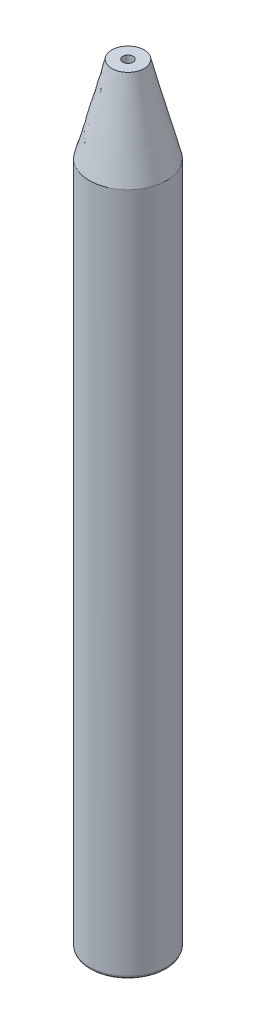
from build123d import *

# Parameters (mm, degrees)
SKETCH1_R           = 3.81
BOSS_EXTRUDE1_DEPTH = 67.7
SKETCH5_R           = 0.508
CUT_EXTRUDE2_DEPTH  = 77.390262478
SKETCH7_R           = 2.61
CUT_EXTRUDE3_DEPTH  = 6
CUT_EXTRUDE3_DRAFT  = -19.33
FILLET3_R           = 0.3


with BuildPart() as part:
    # Sketch1 → Boss-Extrude1 (new body)
    with BuildSketch(Plane(origin=(0, 0, 0), x_dir=(1, 0, 0), z_dir=(0, 1, 0))):
        with Locations(Location((0, 0, 0), (0, 0, 270))):
            Circle(SKETCH1_R)
    extrude(amount=BOSS_EXTRUDE1_DEPTH)

    # Loft1: read off the stored shape, not the designer's step
    # Loft1: loft between two sections, ruled curve by curve
    loft1_from = [
        Edge.make_bspline([(1.215970554, 76.2, 1.039911348), (-0.863852142, 76.2, 3.471852456), (-3.29579325, 76.2, 1.39202976), (-1.215970554, 76.2, -1.039911348), (0.863852142, 76.2, -3.471852456), (3.29579325, 76.2, -1.39202976), (1.215970554, 76.2, 1.039911348)], [0, 0, 0, 0, 0.5, 0.5, 0.5, 1, 1, 1, 1], 3, [1, 0.333333333, 0.333333333, 1, 0.333333333, 0.333333333, 1]),
    ]
    loft1_to = [
        Edge.make_bspline([(2.318114705, 67.7, 3.023647501), (-3.729180297, 67.7, 7.659876912), (-8.365409708, 67.7, 1.612581909), (-2.318114705, 67.7, -3.023647501), (3.729180297, 67.7, -7.659876912), (8.365409708, 67.7, -1.612581909), (2.318114705, 67.7, 3.023647501)], [0, 0, 0, 0, 0.5, 0.5, 0.5, 1, 1, 1, 1], 3, [1, 0.333333333, 0.333333333, 1, 0.333333333, 0.333333333, 1]),
    ]
    loft1 = Solid(Shell([*[Face.make_surface_from_curves(loft1_from[k], loft1_to[k]) for k in range(1)], Face(Wire(loft1_from)), Face(Wire(loft1_to))]))
    add(loft1)

    # Sketch5 → Cut-Extrude2 (cut, through all)
    with BuildSketch(Plane(origin=(0, 76.2, 0), x_dir=(1, 0, 0), z_dir=(0, 1, 0))):
        with Locations(Location((0, 0, 0), (0, 0, 270))):
            Circle(SKETCH5_R)
    extrude(amount=-CUT_EXTRUDE2_DEPTH, mode=Mode.SUBTRACT)


with BuildPart() as cut_extrude3_tool:
    # Sketch7 → Cut-Extrude3 (with draft: the straight prism first)
    with BuildSketch(Plane.XZ):
        Circle(SKETCH7_R)
    extrude(amount=-CUT_EXTRUDE3_DEPTH)
    # Cut-Extrude3: the draft: its side faces are tilted about the plane it starts from
    cut_extrude3_sides = [cut_extrude3_tool.faces().sort_by_distance(p)[0] for p in [
        (-2.61, 3, 0),
    ]]
    draft(cut_extrude3_sides, Plane.XZ, CUT_EXTRUDE3_DRAFT)


with BuildPart() as part_1:
    add(part.part)

    # Cut-Extrude3: cut by cut_extrude3_tool
    add(cut_extrude3_tool.part, mode=Mode.SUBTRACT)

    # Fillet3
    fillet3_edges = [part_1.edges().sort_by_distance(p)[0] for p in [
        (0, 0, -3.81),
    ]]
    fillet(fillet3_edges, radius=FILLET3_R)


solid = part_1.part
